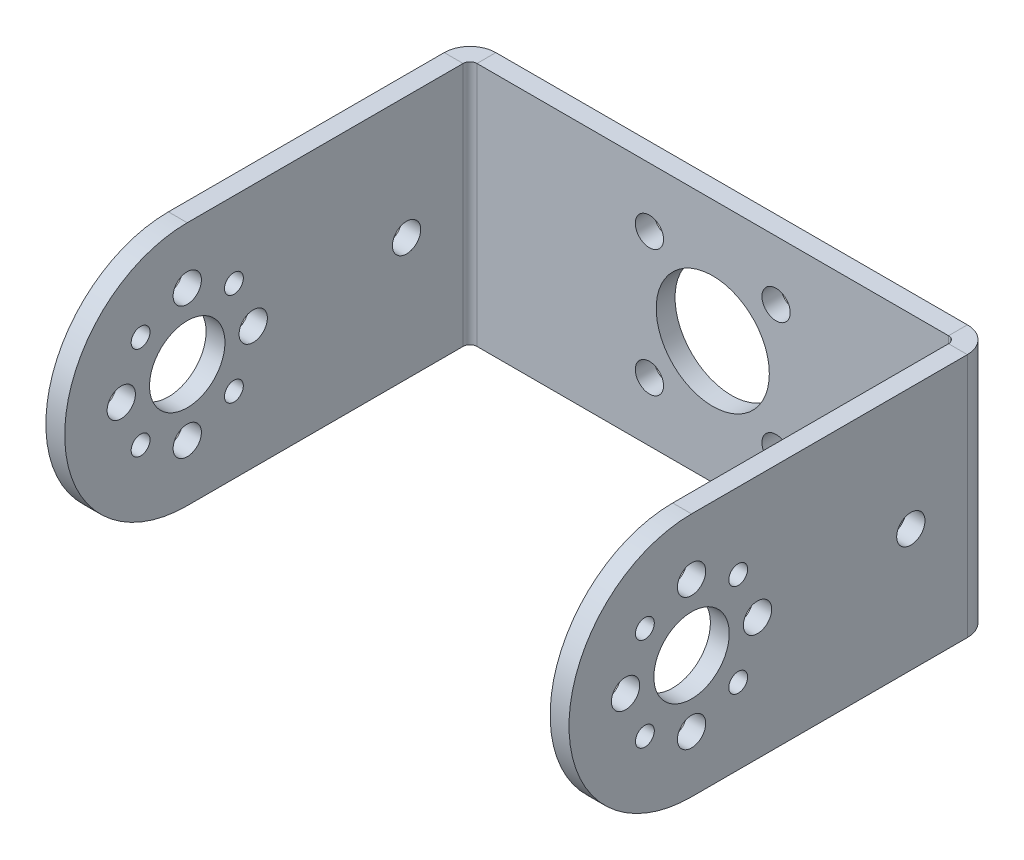
from build123d import *

# Parameters (mm, degrees)
SKETCH_1_W                       = 51.5
SKETCH_1_H                       = 26
SM_BASE_FLANGE_1_DEPTH           = 2
SM_EDGE_FLANGE_1_STRIP_W         = 9.4732
SM_EDGE_FLANGE_1_STRIP_H         = 2
SM_EDGE_FLANGE_1_STRIP_CUT_DEPTH = 26
SM_EDGE_FLANGE_1_DEPTH           = 26
SM_EDGE_FLANGE_2_STRIP_W         = 9.4732
SM_EDGE_FLANGE_2_STRIP_H         = 2
SM_EDGE_FLANGE_2_STRIP_CUT_DEPTH = 26
SM_EDGE_FLANGE_2_DEPTH           = 26
CUT_EXTRUDE_3_DEPTH              = 100
SKETCH_21_R                      = 1
SKETCH_21_R_2                    = 1.5
SKETCH_21_R_3                    = 4
CUT_EXTRUDE_5_DEPTH              = 100
SKETCH_22_R                      = 1.5
SKETCH_22_R_2                    = 6
CUT_EXTRUDE_6_DEPTH              = 3
SKETCH_23_R                      = 1.5
CUT_EXTRUDE_7_DEPTH              = 60


# Sheet-metal steps are written as plain solids
with BuildPart() as part:
    # Sketch 1 → 基体-法兰1 (new body)
    with BuildSketch(Plane.XY):
        with Locations((4.131805158, 0.27256447)):
            Rectangle(SKETCH_1_W, SKETCH_1_H)
    extrude(amount=-SM_BASE_FLANGE_1_DEPTH)

    # 边线-法兰1 strip (across the edge) → 边线-法兰1 strip cut (cut)
    with BuildSketch(Plane(origin=(29.881805158, -12.72743553, 0), x_dir=(-1, 0, 0), z_dir=(0, 1, 0))):
        with Locations((-4, -1)):
            Rectangle(SM_EDGE_FLANGE_1_STRIP_W, SM_EDGE_FLANGE_1_STRIP_H)
    extrude(amount=SM_EDGE_FLANGE_1_STRIP_CUT_DEPTH, mode=Mode.SUBTRACT)

    # 边线-法兰1 section (across the edge) → 边线-法兰1 (add)
    with BuildSketch(Plane(origin=(29.881805158, -12.72743553, 0), x_dir=(-1, 0, 0), z_dir=(0, 1, 0))):
        with BuildLine():
            Line((-2, 0.7366), (-2, 43))
            Line((-2, 43), (0, 43))
            Line((0, 43), (0, 0.7366))
            ThreePointArc((0, 0.7366), (0.215745145, 0.215745145), (0.7366, 0))
            Line((0.7366, 0), (0.7366, -2))
            ThreePointArc((0.7366, -2), (-1.198468417, -1.198468417), (-2, 0.7366))
        make_face()
    extrude(amount=SM_EDGE_FLANGE_1_DEPTH)

    # 边线-法兰2 strip (across the edge) → 边线-法兰2 strip cut (cut)
    with BuildSketch(Plane(origin=(-21.618194842, 13.27256447, 0), x_dir=(1, 0, 0), z_dir=(0, -1, 0))):
        with Locations((-4, -1)):
            Rectangle(SM_EDGE_FLANGE_2_STRIP_W, SM_EDGE_FLANGE_2_STRIP_H)
    extrude(amount=SM_EDGE_FLANGE_2_STRIP_CUT_DEPTH, mode=Mode.SUBTRACT)

    # 边线-法兰2 section (across the edge) → 边线-法兰2 (add)
    with BuildSketch(Plane(origin=(-21.618194842, 13.27256447, 0), x_dir=(1, 0, 0), z_dir=(0, -1, 0))):
        with BuildLine():
            Line((-2, 0.7366), (-2, 43))
            Line((-2, 43), (0, 43))
            Line((0, 43), (0, 0.7366))
            ThreePointArc((0, 0.7366), (0.215745145, 0.215745145), (0.7366, 0))
            Line((0.7366, 0), (0.7366, -2))
            ThreePointArc((0.7366, -2), (-1.198468417, -1.198468417), (-2, 0.7366))
        make_face()
    extrude(amount=SM_EDGE_FLANGE_2_DEPTH)

    # 草图14 → 切除-拉伸3 (cut)
    with BuildSketch(Plane(origin=(31.881805158, 0, 0), x_dir=(0, 0, -1), z_dir=(1, 0, 0))):
        with BuildLine():
            ThreePointArc((-43, 0.27256447), (-39.192388155, 9.464952625), (-30, 13.27256447))
            Line((-30, 13.27256447), (-43, 13.27256447))
            Line((-43, 13.27256447), (-43, 0.27256447))
        make_face()
        with BuildLine():
            Line((-43, -12.72743553), (-30, -12.72743553))
            ThreePointArc((-30, -12.72743553), (-39.192388155, -8.919823686), (-43, 0.27256447))
            Line((-43, 0.27256447), (-43, -12.72743553))
        make_face()
    extrude(amount=-CUT_EXTRUDE_3_DEPTH, mode=Mode.SUBTRACT)

    # 草图21 → 切除-拉伸5 (cut)
    with BuildSketch(Plane(origin=(31.881805158, 0, 0), x_dir=(0, 0, -1), z_dir=(1, 0, 0))):
        with Locations((-25.050252532, 5.222311938)):
            Circle(SKETCH_21_R)
        with Locations((-23, 0.27256447)):
            Circle(SKETCH_21_R_2)
        with Locations((-25.050252532, -4.677182998)):
            Circle(SKETCH_21_R)
        with Locations((-30, -6.72743553)):
            Circle(SKETCH_21_R_2)
        with Locations((-34.949747468, -4.677182998)):
            Circle(SKETCH_21_R)
        with Locations((-37, 0.27256447)):
            Circle(SKETCH_21_R_2)
        with Locations((-34.949747468, 5.222311938)):
            Circle(SKETCH_21_R)
        with Locations((-30, 7.27256447)):
            Circle(SKETCH_21_R_2)
        with Locations((-30, 0.27256447)):
            Circle(SKETCH_21_R_3)
    extrude(amount=-CUT_EXTRUDE_5_DEPTH, mode=Mode.SUBTRACT)

    # 草图22 → 切除-拉伸6 (cut)
    with BuildSketch(Plane.XY):
        with Locations((10.849319579, 6.990078891)):
            Circle(SKETCH_22_R)
        with Locations((10.849319579, -6.444949951)):
            Circle(SKETCH_22_R)
        with Locations((-2.585709264, -6.444949951)):
            Circle(SKETCH_22_R)
        with Locations((-2.585709264, 6.990078891)):
            Circle(SKETCH_22_R)
        with Locations((4.131805158, 0.27256447)):
            Circle(SKETCH_22_R_2)
    extrude(amount=-CUT_EXTRUDE_6_DEPTH, mode=Mode.SUBTRACT)

    # 草图23 → 切除-拉伸7 (cut)
    with BuildSketch(Plane(origin=(31.881805158, 0, 0), x_dir=(0, 0, -1), z_dir=(1, 0, 0))):
        with Locations((-6.7366, 0.27256447)):
            Circle(SKETCH_23_R)
    extrude(amount=-CUT_EXTRUDE_7_DEPTH, mode=Mode.SUBTRACT)


solid = part.part
